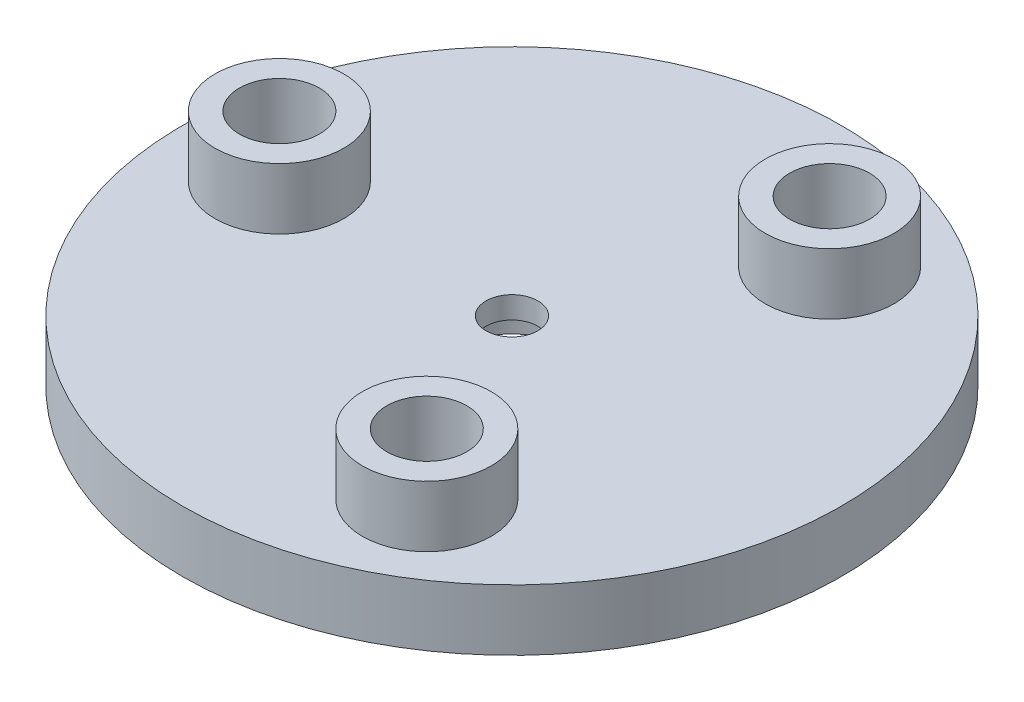
from build123d import *

# Parameters (mm, degrees)
SKETCH2_R           = 27
SKETCH2_R_2         = 2.125
BOSS_EXTRUDE2_DEPTH = 10
SKETCH3_R           = 3.275
CUT_EXTRUDE1_DEPTH  = 7.5
CUT_EXTRUDE2_START  = -5
SKETCH4_R           = 27
SKETCH4_R_2         = 5.275
CUT_EXTRUDE2_DEPTH  = 5
SKETCH5_R           = 5.25
CUT_EXTRUDE3_DEPTH  = 3.2


with BuildPart() as part:
    # Sketch2 → Boss-Extrude2 (new body)
    with BuildSketch(Plane(origin=(0, 0, 0), x_dir=(1, 0, 0), z_dir=(0, 1, 0))):
        Circle(SKETCH2_R)
        Circle(SKETCH2_R_2, mode=Mode.SUBTRACT)
    extrude(amount=BOSS_EXTRUDE2_DEPTH)

    # Sketch3 → Cut-Extrude1 (cut)
    with BuildSketch(Plane.XZ.offset(-10)):
        with Locations((9.52625, -16.499949006)):
            Circle(SKETCH3_R)
        with Locations((9.52625, 16.499949006)):
            Circle(SKETCH3_R)
        with Locations((-19.0525, 0)):
            Circle(SKETCH3_R)
    extrude(amount=CUT_EXTRUDE1_DEPTH, mode=Mode.SUBTRACT)

    # Sketch4 → Cut-Extrude2 (cut)
    with BuildSketch(Plane(origin=(0, 10, 0), x_dir=(1, 0, 0), z_dir=(0, 1, 0)).offset(CUT_EXTRUDE2_START)):
        Circle(SKETCH4_R)
        with Locations((-19.0525, 0)):
            Circle(SKETCH4_R_2, mode=Mode.SUBTRACT)
        with Locations((9.52625, -16.499949006)):
            Circle(SKETCH4_R_2, mode=Mode.SUBTRACT)
        with Locations((9.52625, 16.499949006)):
            Circle(SKETCH4_R_2, mode=Mode.SUBTRACT)
    extrude(amount=CUT_EXTRUDE2_DEPTH, mode=Mode.SUBTRACT)

    # Sketch5 → Cut-Extrude3 (cut)
    with BuildSketch(Plane.XZ):
        Circle(SKETCH5_R)
    extrude(amount=-CUT_EXTRUDE3_DEPTH, mode=Mode.SUBTRACT)


solid = part.part
